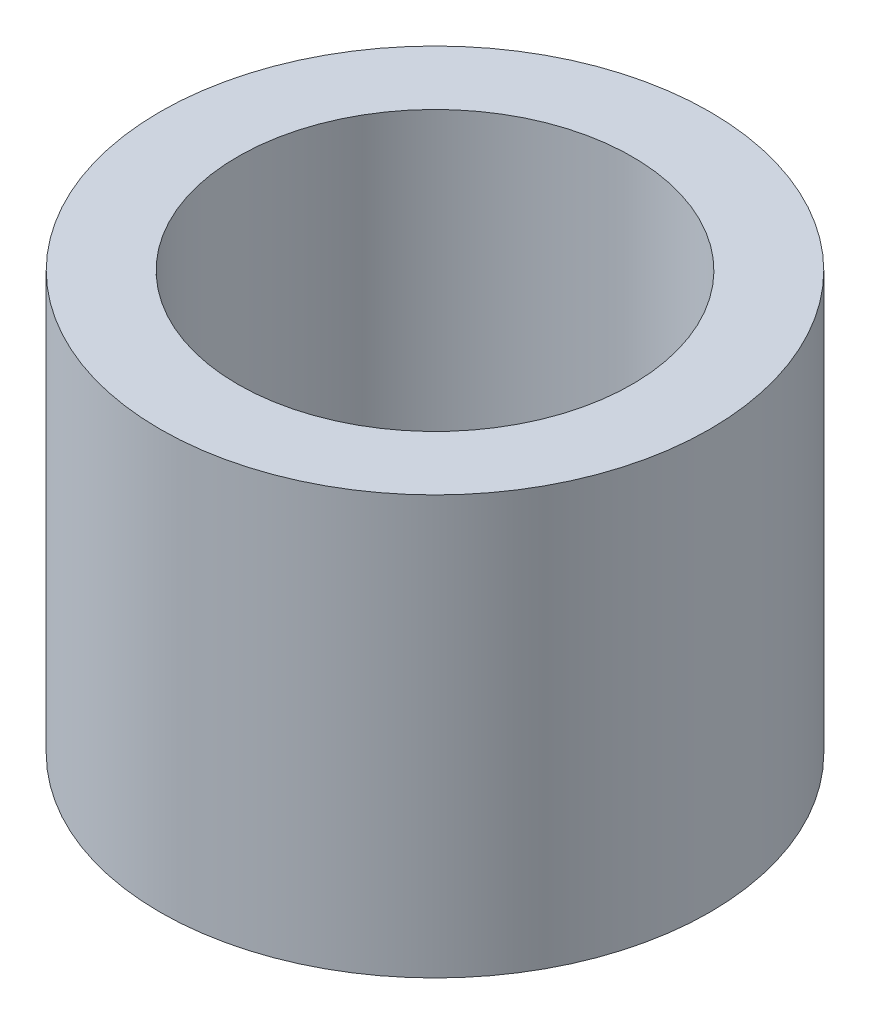
from build123d import *

# Parameters (mm, degrees)
SKETCH_1_R      = 23
EXTRUDE_1_DEPTH = 5
SKETCH_2_R      = 23
SKETCH_2_R_2    = 16.5
EXTRUDE_2_DEPTH = 30


with BuildPart() as part:
    # Эскиз1 → Бобышка-Вытянуть1 (new body)
    with BuildSketch(Plane(origin=(0, 0, 0), x_dir=(1, 0, 0), z_dir=(0, 1, 0))):
        Circle(SKETCH_1_R)
    extrude(amount=EXTRUDE_1_DEPTH)

    # Эскиз2 → Бобышка-Вытянуть2 (add)
    with BuildSketch(Plane(origin=(0, 5, 0), x_dir=(1, 0, 0), z_dir=(0, 1, 0))):
        Circle(SKETCH_2_R)
        Circle(SKETCH_2_R_2, mode=Mode.SUBTRACT)
    extrude(amount=EXTRUDE_2_DEPTH)


solid = part.part
